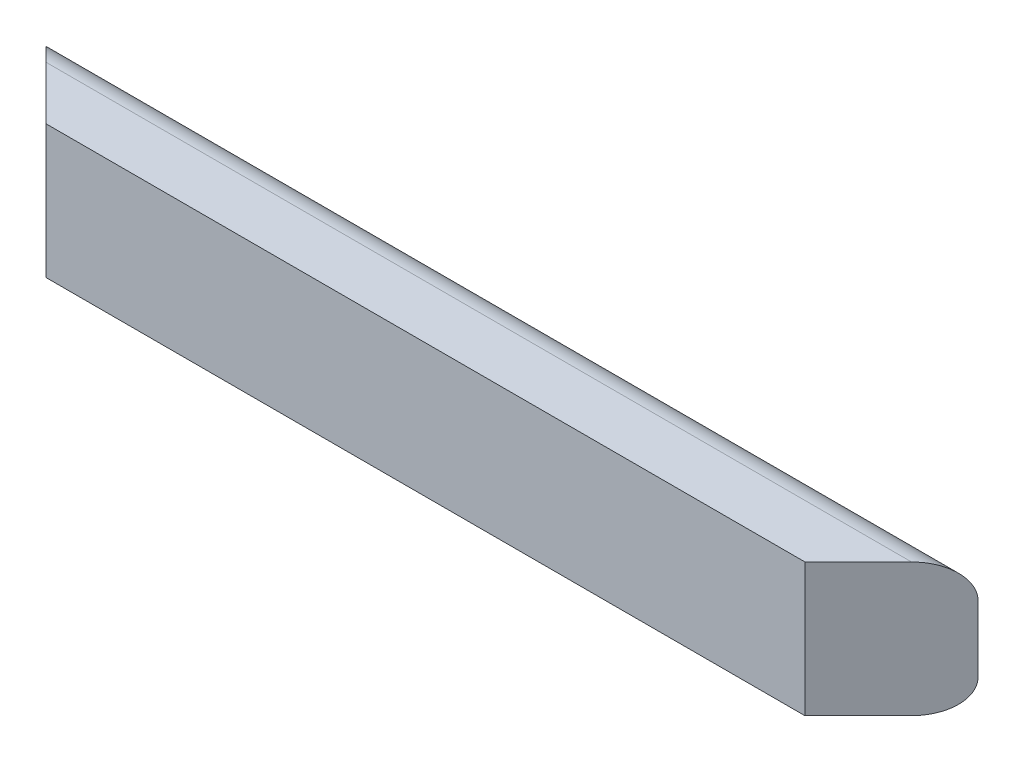
from build123d import *

# Parameters (mm, degrees)
BOSS_EXTRUDE1_DEPTH = 888.6444
SKETCH2_W           = 344.402501539
SKETCH2_H           = 780.457540958
CUT_EXTRUDE1_DEPTH  = 686.141211157


with BuildPart() as part:
    # Sketch1 → Boss-Extrude1 (new body)
    with BuildSketch(Plane(origin=(0, 0, 0), x_dir=(0, 0, -1), z_dir=(1, 0, 0))):
        with BuildLine():
            Line((0, 0), (31.75, 0))
            ThreePointArc((31.75, 0), (54.200640303, 9.299359697), (63.5, 31.75))
            Line((63.5, 31.75), (63.5, 95.25))
            ThreePointArc((63.5, 95.25), (54.200640303, 117.700640303), (31.75, 127))
            Line((31.75, 127), (0, 127))
            Line((0, 127), (-19.05, 127))
            Line((-19.05, 127), (-19.05, 0))
            Line((-19.05, 0), (0, 0))
        make_face()
    extrude(amount=BOSS_EXTRUDE1_DEPTH)

    # Sketch2 → Cut-Extrude1 (cut, through all)
    with BuildSketch(Plane(origin=(412.5722, 0, 412.5722), x_dir=(0, 1, 0), z_dir=(0.7071067811865464, 0, 0.7071067811865488))):
        with Locations((32.995160032, -673.267761909)):
            Rectangle(SKETCH2_W, SKETCH2_H)
    cut_extrude1 = extrude(amount=CUT_EXTRUDE1_DEPTH, mode=Mode.SUBTRACT)

    # Mirror1: Cut-Extrude1 across plane
    add(cut_extrude1.mirror(Plane(origin=(444.3222, 0, 0), x_dir=(0, 0, 1), z_dir=(1, 0, 0))), mode=Mode.SUBTRACT)


solid = part.part
